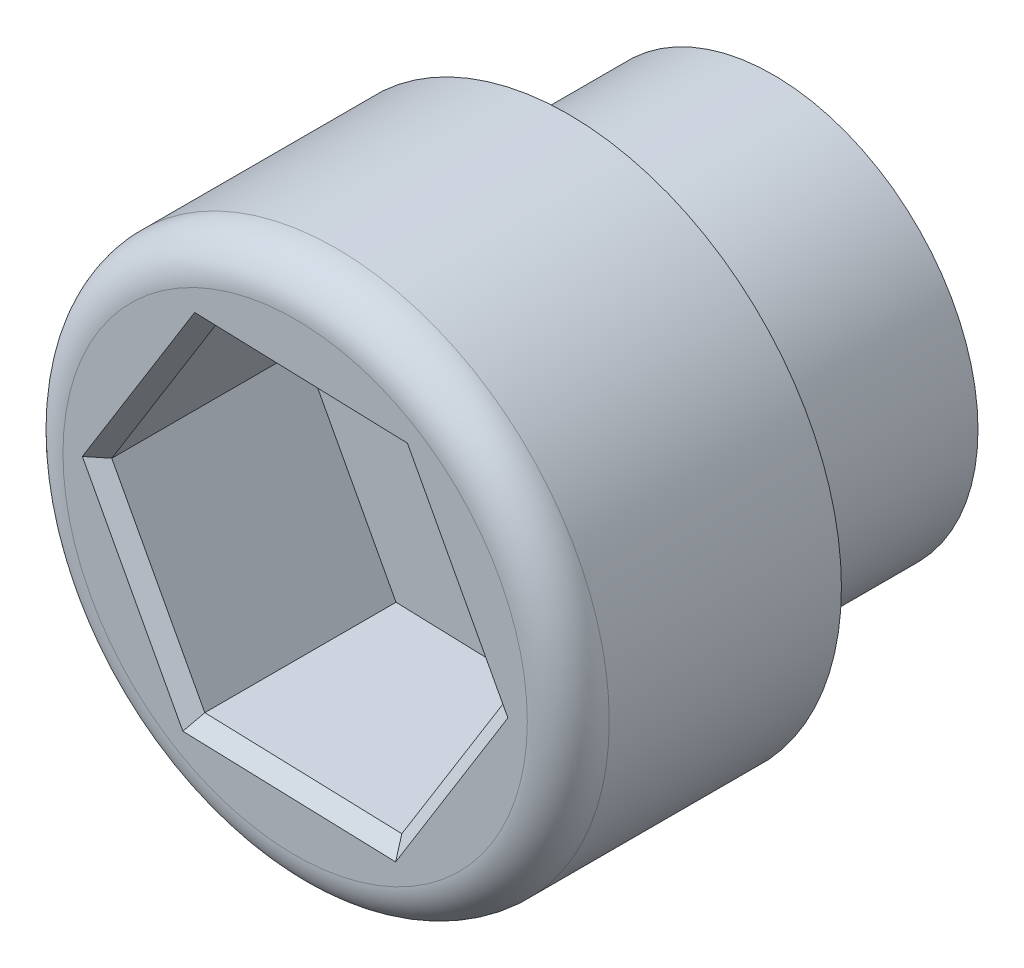
from build123d import *

# Parameters (mm, degrees)
SZKIC1_R                    = 3
DODANIE_WYCI_GNI_CIE1_DEPTH = 3
SZKIC2_R                    = 4
DODANIE_WYCI_GNI_CIE2_DEPTH = 4
WYTNIJ_WYCI_GNI_CIE1_DEPTH  = 3
ZAOKR_GLENIE1_R             = 0.6
SFAZOWANIE1_SIZE            = 0.2


with BuildPart() as part:
    # Szkic1 → Dodanie-wyciągnięcie1 (new body)
    with BuildSketch(Plane.XY):
        Circle(SZKIC1_R)
    extrude(amount=DODANIE_WYCI_GNI_CIE1_DEPTH)

    # Szkic2 → Dodanie-wyciągnięcie2 (add)
    with BuildSketch(Plane.XY.offset(3)):
        Circle(SZKIC2_R)
    extrude(amount=DODANIE_WYCI_GNI_CIE2_DEPTH)

    # Szkic3 → Wytnij-wyciągnięcie1 (cut)
    with BuildSketch(Plane.XY.offset(7)):
        Polygon((-1.362395968, 2.545036456), (-2.885264208, 0.09264871), (-1.52286824, -2.452387746), (1.362395968, -2.545036456), (2.885264208, -0.09264871), (1.52286824, 2.452387746), align=None)
    extrude(amount=-WYTNIJ_WYCI_GNI_CIE1_DEPTH, mode=Mode.SUBTRACT)

    # Zaokrąglenie1
    zaokr_glenie1_edges = [part.edges().sort_by_distance(p)[0] for p in [
        (-4, 0, 7),
    ]]
    fillet(zaokr_glenie1_edges, radius=ZAOKR_GLENIE1_R)

    # Sfazowanie1
    sfazowanie1_edges = [part.edges().sort_by_distance(p)[0] for p in [
        (-0.080236136, -2.498712101, 7),
        (-2.204066224, -1.179869518, 7),
        (-2.123830088, 1.318842583, 7),
        (0.080236136, 2.498712101, 7),
        (2.204066224, 1.179869518, 7),
        (2.123830088, -1.318842583, 7),
    ]]
    chamfer(sfazowanie1_edges, length=SFAZOWANIE1_SIZE)


solid = part.part
